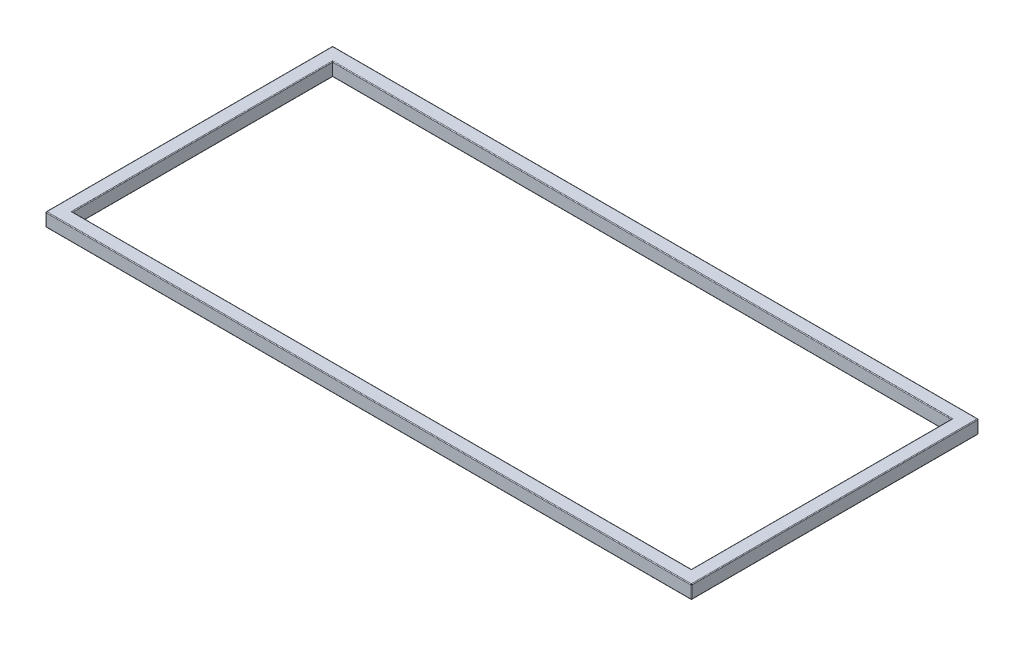
from build123d import *

# Parameters (mm, degrees)
SKETCH1_W           = 914.4
SKETCH1_H           = 406.4
SKETCH1_W_2         = 876.3
SKETCH1_H_2         = 368.3
BOSS_EXTRUDE1_DEPTH = 19.05
FILLET1_R           = 1.016
FILLET2_R           = 1.016


with BuildPart() as part:
    # Sketch1 → Boss-Extrude1 (new body)
    with BuildSketch(Plane(origin=(0, 0, 0), x_dir=(1, 0, 0), z_dir=(0, 1, 0))):
        Rectangle(SKETCH1_W, SKETCH1_H)
        Rectangle(SKETCH1_W_2, SKETCH1_H_2, mode=Mode.SUBTRACT)
    extrude(amount=BOSS_EXTRUDE1_DEPTH)

    # Fillet1
    fillet1_edges = [part.edges().sort_by_distance(p)[0] for p in [
        (-457.2, 19.05, 0),
        (438.15, 0, 0),
        (0, 0, -184.15),
        (-438.15, 0, 0),
        (0, 0, 184.15),
        (438.15, 19.05, 0),
        (0, 19.05, 203.2),
        (0, 19.05, -184.15),
        (-438.15, 19.05, 0),
        (0, 19.05, 184.15),
        (457.2, 19.05, 0),
        (0, 0, 203.2),
        (-457.2, 0, 0),
        (0, 0, -203.2),
        (457.2, 0, 0),
        (0, 19.05, -203.2),
    ]]
    fillet(fillet1_edges, radius=FILLET1_R)

    # Fillet2
    # the kernel refuses this fillet: 1.016 mm, written as the material it takes off along each edge
    with BuildSketch(Plane(origin=(456.184, 1.016, 202.184), x_dir=(1, 0, 0), z_dir=(0, 0, 1))) as fillet2_piece_1_section:
        Polygon((0, 0), (FILLET2_R * 1.02, 0), (FILLET2_R * 1.02, -FILLET2_R * 1.02), (0, -FILLET2_R * 1.02), align=None)
    fillet2_piece_1 = extrude(amount=FILLET2_R * 1.02, mode=Mode.PRIVATE)
    fillet2_piece_1 = fillet2_piece_1 - Plane(origin=(456.184, 1.016, 202.184), x_dir=(-0.7071067811865475, 0.7071067811865475, 0), z_dir=(0, 0, 1)) * Sphere(FILLET2_R, mode=Mode.PRIVATE)
    add(fillet2_piece_1, mode=Mode.SUBTRACT)
    with BuildSketch(Plane(origin=(-456.184, 1.016, 202.184), x_dir=(-1, 0, 0), z_dir=(0, 0, 1))) as fillet2_piece_2_section:
        Polygon((0, 0), (FILLET2_R * 1.02, 0), (FILLET2_R * 1.02, FILLET2_R * 1.02), (0, FILLET2_R * 1.02), align=None)
    fillet2_piece_2 = extrude(amount=FILLET2_R * 1.02, mode=Mode.PRIVATE)
    fillet2_piece_2 = fillet2_piece_2 - Plane(origin=(-456.184, 1.016, 202.184), x_dir=(0.7071067811865475, 0.7071067811865475, 0), z_dir=(0, 0, 1)) * Sphere(FILLET2_R, mode=Mode.PRIVATE)
    add(fillet2_piece_2, mode=Mode.SUBTRACT)
    with BuildSketch(Plane(origin=(456.184, 1.016, -202.184), x_dir=(0, 0, -1), z_dir=(1, 0, 0))) as fillet2_piece_3_section:
        Polygon((0, 0), (FILLET2_R * 1.02, 0), (FILLET2_R * 1.02, -FILLET2_R * 1.02), (0, -FILLET2_R * 1.02), align=None)
    fillet2_piece_3 = extrude(amount=FILLET2_R * 1.02, mode=Mode.PRIVATE)
    fillet2_piece_3 = fillet2_piece_3 - Plane(origin=(456.184, 1.016, -202.184), x_dir=(0, 0.7071067811865475, 0.7071067811865475), z_dir=(1, 0, 0)) * Sphere(FILLET2_R, mode=Mode.PRIVATE)
    add(fillet2_piece_3, mode=Mode.SUBTRACT)
    with BuildSketch(Plane(origin=(-456.184, 1.016, -202.184), x_dir=(0, 0, -1), z_dir=(-1, 0, 0))) as fillet2_piece_4_section:
        Polygon((0, 0), (FILLET2_R * 1.02, 0), (FILLET2_R * 1.02, FILLET2_R * 1.02), (0, FILLET2_R * 1.02), align=None)
    fillet2_piece_4 = extrude(amount=FILLET2_R * 1.02, mode=Mode.PRIVATE)
    fillet2_piece_4 = fillet2_piece_4 - Plane(origin=(-456.184, 1.016, -202.184), x_dir=(0, 0.7071067811865475, 0.7071067811865475), z_dir=(-1, 0, 0)) * Sphere(FILLET2_R, mode=Mode.PRIVATE)
    add(fillet2_piece_4, mode=Mode.SUBTRACT)
    with BuildSketch(Plane(origin=(-456.184, 18.034, -202.184), x_dir=(0, 0, -1), z_dir=(-1, 0, 0))) as fillet2_piece_5_section:
        Polygon((0, 0), (FILLET2_R * 1.02, 0), (FILLET2_R * 1.02, -FILLET2_R * 1.02), (0, -FILLET2_R * 1.02), align=None)
    fillet2_piece_5 = extrude(amount=FILLET2_R * 1.02, mode=Mode.PRIVATE)
    fillet2_piece_5 = fillet2_piece_5 - Plane(origin=(-456.184, 18.034, -202.184), x_dir=(0, -0.7071067811865475, 0.7071067811865475), z_dir=(-1, 0, 0)) * Sphere(FILLET2_R, mode=Mode.PRIVATE)
    add(fillet2_piece_5, mode=Mode.SUBTRACT)
    with BuildSketch(Plane(origin=(456.184, 18.034, -202.184), x_dir=(0, 0, -1), z_dir=(1, 0, 0))) as fillet2_piece_6_section:
        Polygon((0, 0), (FILLET2_R * 1.02, 0), (FILLET2_R * 1.02, FILLET2_R * 1.02), (0, FILLET2_R * 1.02), align=None)
    fillet2_piece_6 = extrude(amount=FILLET2_R * 1.02, mode=Mode.PRIVATE)
    fillet2_piece_6 = fillet2_piece_6 - Plane(origin=(456.184, 18.034, -202.184), x_dir=(0, -0.7071067811865475, 0.7071067811865475), z_dir=(1, 0, 0)) * Sphere(FILLET2_R, mode=Mode.PRIVATE)
    add(fillet2_piece_6, mode=Mode.SUBTRACT)
    with BuildSketch(Plane(origin=(-456.184, 18.034, 202.184), x_dir=(-1, 0, 0), z_dir=(0, 0, 1))) as fillet2_piece_7_section:
        Polygon((0, 0), (FILLET2_R * 1.02, 0), (FILLET2_R * 1.02, -FILLET2_R * 1.02), (0, -FILLET2_R * 1.02), align=None)
    fillet2_piece_7 = extrude(amount=FILLET2_R * 1.02, mode=Mode.PRIVATE)
    fillet2_piece_7 = fillet2_piece_7 - Plane(origin=(-456.184, 18.034, 202.184), x_dir=(0.7071067811865475, -0.7071067811865475, 0), z_dir=(0, 0, 1)) * Sphere(FILLET2_R, mode=Mode.PRIVATE)
    add(fillet2_piece_7, mode=Mode.SUBTRACT)
    with BuildSketch(Plane(origin=(456.184, 18.034, 202.184), x_dir=(1, 0, 0), z_dir=(0, 0, 1))) as fillet2_piece_8_section:
        Polygon((0, 0), (FILLET2_R * 1.02, 0), (FILLET2_R * 1.02, FILLET2_R * 1.02), (0, FILLET2_R * 1.02), align=None)
    fillet2_piece_8 = extrude(amount=FILLET2_R * 1.02, mode=Mode.PRIVATE)
    fillet2_piece_8 = fillet2_piece_8 - Plane(origin=(456.184, 18.034, 202.184), x_dir=(-0.7071067811865475, -0.7071067811865475, 0), z_dir=(0, 0, 1)) * Sphere(FILLET2_R, mode=Mode.PRIVATE)
    add(fillet2_piece_8, mode=Mode.SUBTRACT)
    with BuildSketch(Plane(origin=(-457.2, 1.016, -203.2), x_dir=(0, 0, 1), z_dir=(0, 1, 0)), Plane(origin=(-457.2, 1.016, 203.2), x_dir=(1, 0, 0), z_dir=(0, 1, 0))) as fillet2_piece_9:
        with BuildLine():
            CenterArc((FILLET2_R, FILLET2_R), FILLET2_R, 180, 90)
            Line((0, FILLET2_R), (0, 0))
            Line((0, 0), (FILLET2_R, 0))
        make_face()
    extrude(amount=17.018, mode=Mode.SUBTRACT)
    with BuildSketch(Plane(origin=(457.2, 1.016, -203.2), x_dir=(0, 0, 1), z_dir=(0, 1, 0)), Plane(origin=(457.2, 1.016, 203.2), x_dir=(-1, 0, 0), z_dir=(0, 1, 0))) as fillet2_piece_10:
        with BuildLine():
            CenterArc((FILLET2_R, -FILLET2_R), FILLET2_R, 90, 90)
            Line((0, -FILLET2_R), (0, 0))
            Line((0, 0), (FILLET2_R, 0))
        make_face()
    extrude(amount=17.018, mode=Mode.SUBTRACT)


solid = part.part
